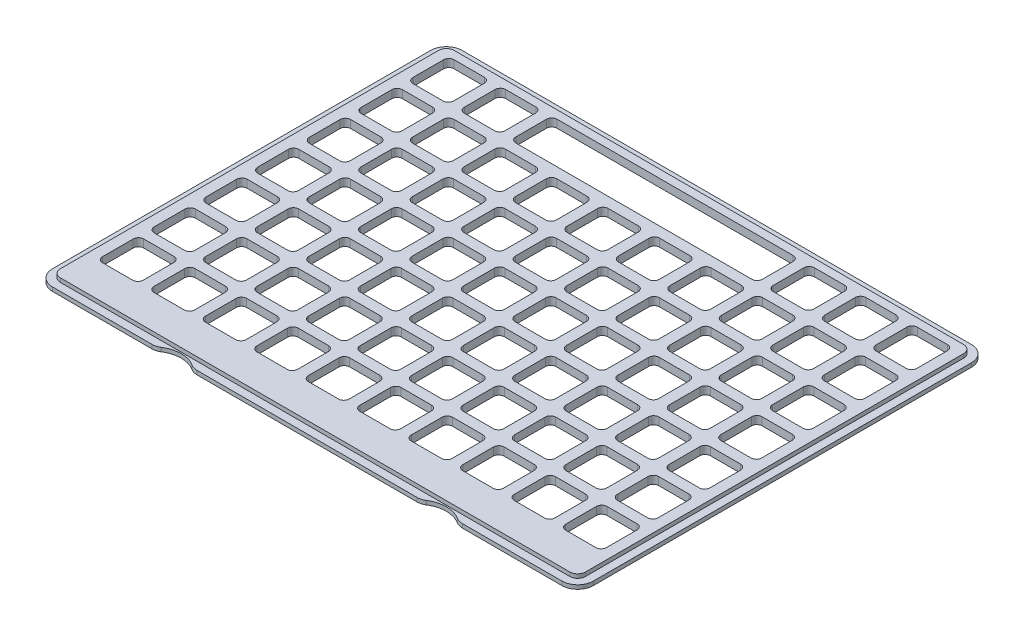
from build123d import *

# Parameters (mm, degrees)
SKETCH1_W               = 206
SKETCH1_H               = 156
OUTER_PROFILE_DEPTH     = 1.5
SKETCH2_W               = 200
SKETCH2_H               = 150
INNER_PROFILE_DEPTH     = 1.5
FILLET1_R               = 3
FILLET2_R               = 6
SKETCH5_W               = 15.5
SKETCH5_H               = 15.7
CUTOUT_DEPTH            = 130.236217834
CORNER_RAD_R            = 2
LPATTERN1_DEPTH         = 3
SKETCH6_W               = 89.9
SKETCH6_H               = 15.7
CUT_EXTRUDE1_DEPTH      = 130.236217834
BASE_RIDGE_DEPTH        = 130.236217834
CORNER_R                = 5
CORNER_OF_BASE_RIDGES_R = 5


# Read off the part's stored shape, not the designer's step: LPattern1
with BuildPart() as part:
    # Sketch1 → Outer Profile (new body)
    with BuildSketch(Plane(origin=(0, 0, 0), x_dir=(1, 0, 0), z_dir=(0, 1, 0))):
        Rectangle(SKETCH1_W, SKETCH1_H)
    extrude(amount=OUTER_PROFILE_DEPTH)

    # Sketch2 → Inner Profile (add)
    with BuildSketch(Plane(origin=(0, 1.5, 0), x_dir=(1, 0, 0), z_dir=(0, 1, 0))):
        Rectangle(SKETCH2_W, SKETCH2_H)
    extrude(amount=INNER_PROFILE_DEPTH)

    # Fillet1
    fillet1_edges = [part.edges().sort_by_distance(p)[0] for p in [
        (100, 2.25, 75),
        (100, 2.25, -75),
        (-100, 2.25, -75),
        (-100, 2.25, 75),
    ]]
    fillet(fillet1_edges, radius=FILLET1_R)

    # Fillet2
    fillet2_edges = [part.edges().sort_by_distance(p)[0] for p in [
        (103, 0.75, 78),
        (-103, 0.75, 78),
        (-103, 0.75, -78),
        (103, 0.75, -78),
    ]]
    fillet(fillet2_edges, radius=FILLET2_R)

    # Sketch5 → Cutout (cut, through all)
    with BuildSketch(Plane(origin=(0, 3, 0), x_dir=(1, 0, 0), z_dir=(0, 1, 0))):
        with Locations((-88.2, -54.15)):
            Rectangle(SKETCH5_W, SKETCH5_H)
    extrude(amount=-CUTOUT_DEPTH, mode=Mode.SUBTRACT)

    # Corner Rad
    corner_rad_edges = [part.edges().sort_by_distance(p)[0] for p in [
        (-95.95, 1.5, 62),
        (-95.95, 1.5, 46.3),
        (-80.45, 1.5, 46.3),
        (-80.45, 1.5, 62),
    ]]
    fillet(corner_rad_edges, radius=CORNER_RAD_R)

    # LPattern1 outline → LPattern1 (cut)
    with BuildSketch(Plane(origin=(0, 0, 0), x_dir=(1, 0, 0), z_dir=(0, 1, 0))):
        with BuildLine():
            ThreePointArc((-93.95, -26.6), (-95.364213562, -27.185786438), (-95.95, -28.6))
            Line((-95.95, -28.6), (-95.95, -40.3))
            ThreePointArc((-95.95, -40.3), (-95.364213562, -41.714213562), (-93.95, -42.3))
            Line((-93.95, -42.3), (-82.45, -42.3))
            ThreePointArc((-82.45, -42.3), (-81.035786438, -41.714213562), (-80.45, -40.3))
            Line((-80.45, -40.3), (-80.45, -28.6))
            ThreePointArc((-80.45, -28.6), (-81.035786438, -27.185786438), (-82.45, -26.6))
            Line((-82.45, -26.6), (-93.95, -26.6))
        make_face()
        with BuildLine():
            ThreePointArc((-93.95, -6.9), (-95.364213562, -7.485786438), (-95.95, -8.9))
            Line((-95.95, -8.9), (-95.95, -20.6))
            ThreePointArc((-95.95, -20.6), (-95.364213562, -22.014213562), (-93.95, -22.6))
            Line((-93.95, -22.6), (-82.45, -22.6))
            ThreePointArc((-82.45, -22.6), (-81.035786438, -22.014213562), (-80.45, -20.6))
            Line((-80.45, -20.6), (-80.45, -8.9))
            ThreePointArc((-80.45, -8.9), (-81.035786438, -7.485786438), (-82.45, -6.9))
            Line((-82.45, -6.9), (-93.95, -6.9))
        make_face()
        with BuildLine():
            ThreePointArc((-93.95, 12.8), (-95.364213562, 12.214213562), (-95.95, 10.8))
            Line((-95.95, 10.8), (-95.95, -0.9))
            ThreePointArc((-95.95, -0.9), (-95.364213562, -2.314213562), (-93.95, -2.9))
            Line((-93.95, -2.9), (-82.45, -2.9))
            ThreePointArc((-82.45, -2.9), (-81.035786438, -2.314213562), (-80.45, -0.9))
            Line((-80.45, -0.9), (-80.45, 10.8))
            ThreePointArc((-80.45, 10.8), (-81.035786438, 12.214213562), (-82.45, 12.8))
            Line((-82.45, 12.8), (-93.95, 12.8))
        make_face()
        with BuildLine():
            ThreePointArc((-93.95, 32.5), (-95.364213562, 31.914213562), (-95.95, 30.5))
            Line((-95.95, 30.5), (-95.95, 18.8))
            ThreePointArc((-95.95, 18.8), (-95.364213562, 17.385786438), (-93.95, 16.8))
            Line((-93.95, 16.8), (-82.45, 16.8))
            ThreePointArc((-82.45, 16.8), (-81.035786438, 17.385786438), (-80.45, 18.8))
            Line((-80.45, 18.8), (-80.45, 30.5))
            ThreePointArc((-80.45, 30.5), (-81.035786438, 31.914213562), (-82.45, 32.5))
            Line((-82.45, 32.5), (-93.95, 32.5))
        make_face()
        with BuildLine():
            ThreePointArc((-93.95, 52.2), (-95.364213562, 51.614213562), (-95.95, 50.2))
            Line((-95.95, 50.2), (-95.95, 38.5))
            ThreePointArc((-95.95, 38.5), (-95.364213562, 37.085786438), (-93.95, 36.5))
            Line((-93.95, 36.5), (-82.45, 36.5))
            ThreePointArc((-82.45, 36.5), (-81.035786438, 37.085786438), (-80.45, 38.5))
            Line((-80.45, 38.5), (-80.45, 50.2))
            ThreePointArc((-80.45, 50.2), (-81.035786438, 51.614213562), (-82.45, 52.2))
            Line((-82.45, 52.2), (-93.95, 52.2))
        make_face()
        with BuildLine():
            ThreePointArc((-93.95, 71.9), (-95.364213562, 71.314213562), (-95.95, 69.9))
            Line((-95.95, 69.9), (-95.95, 58.2))
            ThreePointArc((-95.95, 58.2), (-95.364213562, 56.785786438), (-93.95, 56.2))
            Line((-93.95, 56.2), (-82.45, 56.2))
            ThreePointArc((-82.45, 56.2), (-81.035786438, 56.785786438), (-80.45, 58.2))
            Line((-80.45, 58.2), (-80.45, 69.9))
            ThreePointArc((-80.45, 69.9), (-81.035786438, 71.314213562), (-82.45, 71.9))
            Line((-82.45, 71.9), (-93.95, 71.9))
        make_face()
        with BuildLine():
            ThreePointArc((-60.85, -48.3), (-61.435786438, -46.885786438), (-62.85, -46.3))
            Line((-62.85, -46.3), (-74.35, -46.3))
            ThreePointArc((-74.35, -46.3), (-75.764213562, -46.885786438), (-76.35, -48.3))
            Line((-76.35, -48.3), (-76.35, -60))
            ThreePointArc((-76.35, -60), (-75.764213562, -61.414213562), (-74.35, -62))
            Line((-74.35, -62), (-62.85, -62))
            ThreePointArc((-62.85, -62), (-61.435786438, -61.414213562), (-60.85, -60))
            Line((-60.85, -60), (-60.85, -48.3))
        make_face()
        with BuildLine():
            ThreePointArc((-41.25, -48.3), (-41.835786438, -46.885786438), (-43.25, -46.3))
            Line((-43.25, -46.3), (-54.75, -46.3))
            ThreePointArc((-54.75, -46.3), (-56.164213562, -46.885786438), (-56.75, -48.3))
            Line((-56.75, -48.3), (-56.75, -60))
            ThreePointArc((-56.75, -60), (-56.164213562, -61.414213562), (-54.75, -62))
            Line((-54.75, -62), (-43.25, -62))
            ThreePointArc((-43.25, -62), (-41.835786438, -61.414213562), (-41.25, -60))
            Line((-41.25, -60), (-41.25, -48.3))
        make_face()
        with BuildLine():
            ThreePointArc((-21.65, -48.3), (-22.235786438, -46.885786438), (-23.65, -46.3))
            Line((-23.65, -46.3), (-35.15, -46.3))
            ThreePointArc((-35.15, -46.3), (-36.564213562, -46.885786438), (-37.15, -48.3))
            Line((-37.15, -48.3), (-37.15, -60))
            ThreePointArc((-37.15, -60), (-36.564213562, -61.414213562), (-35.15, -62))
            Line((-35.15, -62), (-23.65, -62))
            ThreePointArc((-23.65, -62), (-22.235786438, -61.414213562), (-21.65, -60))
            Line((-21.65, -60), (-21.65, -48.3))
        make_face()
        with BuildLine():
            ThreePointArc((-2.05, -48.3), (-2.635786438, -46.885786438), (-4.05, -46.3))
            Line((-4.05, -46.3), (-15.55, -46.3))
            ThreePointArc((-15.55, -46.3), (-16.964213562, -46.885786438), (-17.55, -48.3))
            Line((-17.55, -48.3), (-17.55, -60))
            ThreePointArc((-17.55, -60), (-16.964213562, -61.414213562), (-15.55, -62))
            Line((-15.55, -62), (-4.05, -62))
            ThreePointArc((-4.05, -62), (-2.635786438, -61.414213562), (-2.05, -60))
            Line((-2.05, -60), (-2.05, -48.3))
        make_face()
        with BuildLine():
            ThreePointArc((17.55, -48.3), (16.964213562, -46.885786438), (15.55, -46.3))
            Line((15.55, -46.3), (4.05, -46.3))
            ThreePointArc((4.05, -46.3), (2.635786438, -46.885786438), (2.05, -48.3))
            Line((2.05, -48.3), (2.05, -60))
            ThreePointArc((2.05, -60), (2.635786438, -61.414213562), (4.05, -62))
            Line((4.05, -62), (15.55, -62))
            ThreePointArc((15.55, -62), (16.964213562, -61.414213562), (17.55, -60))
            Line((17.55, -60), (17.55, -48.3))
        make_face()
        with BuildLine():
            ThreePointArc((37.15, -48.3), (36.564213562, -46.885786438), (35.15, -46.3))
            Line((35.15, -46.3), (23.65, -46.3))
            ThreePointArc((23.65, -46.3), (22.235786438, -46.885786438), (21.65, -48.3))
            Line((21.65, -48.3), (21.65, -60))
            ThreePointArc((21.65, -60), (22.235786438, -61.414213562), (23.65, -62))
            Line((23.65, -62), (35.15, -62))
            ThreePointArc((35.15, -62), (36.564213562, -61.414213562), (37.15, -60))
            Line((37.15, -60), (37.15, -48.3))
        make_face()
        with BuildLine():
            ThreePointArc((56.75, -48.3), (56.164213562, -46.885786438), (54.75, -46.3))
            Line((54.75, -46.3), (43.25, -46.3))
            ThreePointArc((43.25, -46.3), (41.835786438, -46.885786438), (41.25, -48.3))
            Line((41.25, -48.3), (41.25, -60))
            ThreePointArc((41.25, -60), (41.835786438, -61.414213562), (43.25, -62))
            Line((43.25, -62), (54.75, -62))
            ThreePointArc((54.75, -62), (56.164213562, -61.414213562), (56.75, -60))
            Line((56.75, -60), (56.75, -48.3))
        make_face()
        with BuildLine():
            ThreePointArc((76.35, -48.3), (75.764213562, -46.885786438), (74.35, -46.3))
            Line((74.35, -46.3), (62.85, -46.3))
            ThreePointArc((62.85, -46.3), (61.435786438, -46.885786438), (60.85, -48.3))
            Line((60.85, -48.3), (60.85, -60))
            ThreePointArc((60.85, -60), (61.435786438, -61.414213562), (62.85, -62))
            Line((62.85, -62), (74.35, -62))
            ThreePointArc((74.35, -62), (75.764213562, -61.414213562), (76.35, -60))
            Line((76.35, -60), (76.35, -48.3))
        make_face()
        with BuildLine():
            ThreePointArc((95.95, -48.3), (95.364213562, -46.885786438), (93.95, -46.3))
            Line((93.95, -46.3), (82.45, -46.3))
            ThreePointArc((82.45, -46.3), (81.035786438, -46.885786438), (80.45, -48.3))
            Line((80.45, -48.3), (80.45, -60))
            ThreePointArc((80.45, -60), (81.035786438, -61.414213562), (82.45, -62))
            Line((82.45, -62), (93.95, -62))
            ThreePointArc((93.95, -62), (95.364213562, -61.414213562), (95.95, -60))
            Line((95.95, -60), (95.95, -48.3))
        make_face()
        with BuildLine():
            ThreePointArc((-60.85, -28.6), (-61.435786438, -27.185786438), (-62.85, -26.6))
            Line((-62.85, -26.6), (-74.35, -26.6))
            ThreePointArc((-74.35, -26.6), (-75.764213562, -27.185786438), (-76.35, -28.6))
            Line((-76.35, -28.6), (-76.35, -40.3))
            ThreePointArc((-76.35, -40.3), (-75.764213562, -41.714213562), (-74.35, -42.3))
            Line((-74.35, -42.3), (-62.85, -42.3))
            ThreePointArc((-62.85, -42.3), (-61.435786438, -41.714213562), (-60.85, -40.3))
            Line((-60.85, -40.3), (-60.85, -28.6))
        make_face()
        with BuildLine():
            ThreePointArc((-41.25, -28.6), (-41.835786438, -27.185786438), (-43.25, -26.6))
            Line((-43.25, -26.6), (-54.75, -26.6))
            ThreePointArc((-54.75, -26.6), (-56.164213562, -27.185786438), (-56.75, -28.6))
            Line((-56.75, -28.6), (-56.75, -40.3))
            ThreePointArc((-56.75, -40.3), (-56.164213562, -41.714213562), (-54.75, -42.3))
            Line((-54.75, -42.3), (-43.25, -42.3))
            ThreePointArc((-43.25, -42.3), (-41.835786438, -41.714213562), (-41.25, -40.3))
            Line((-41.25, -40.3), (-41.25, -28.6))
        make_face()
        with BuildLine():
            ThreePointArc((-21.65, -28.6), (-22.235786438, -27.185786438), (-23.65, -26.6))
            Line((-23.65, -26.6), (-35.15, -26.6))
            ThreePointArc((-35.15, -26.6), (-36.564213562, -27.185786438), (-37.15, -28.6))
            Line((-37.15, -28.6), (-37.15, -40.3))
            ThreePointArc((-37.15, -40.3), (-36.564213562, -41.714213562), (-35.15, -42.3))
            Line((-35.15, -42.3), (-23.65, -42.3))
            ThreePointArc((-23.65, -42.3), (-22.235786438, -41.714213562), (-21.65, -40.3))
            Line((-21.65, -40.3), (-21.65, -28.6))
        make_face()
        with BuildLine():
            ThreePointArc((-2.05, -28.6), (-2.635786438, -27.185786438), (-4.05, -26.6))
            Line((-4.05, -26.6), (-15.55, -26.6))
            ThreePointArc((-15.55, -26.6), (-16.964213562, -27.185786438), (-17.55, -28.6))
            Line((-17.55, -28.6), (-17.55, -40.3))
            ThreePointArc((-17.55, -40.3), (-16.964213562, -41.714213562), (-15.55, -42.3))
            Line((-15.55, -42.3), (-4.05, -42.3))
            ThreePointArc((-4.05, -42.3), (-2.635786438, -41.714213562), (-2.05, -40.3))
            Line((-2.05, -40.3), (-2.05, -28.6))
        make_face()
        with BuildLine():
            ThreePointArc((17.55, -28.6), (16.964213562, -27.185786438), (15.55, -26.6))
            Line((15.55, -26.6), (4.05, -26.6))
            ThreePointArc((4.05, -26.6), (2.635786438, -27.185786438), (2.05, -28.6))
            Line((2.05, -28.6), (2.05, -40.3))
            ThreePointArc((2.05, -40.3), (2.635786438, -41.714213562), (4.05, -42.3))
            Line((4.05, -42.3), (15.55, -42.3))
            ThreePointArc((15.55, -42.3), (16.964213562, -41.714213562), (17.55, -40.3))
            Line((17.55, -40.3), (17.55, -28.6))
        make_face()
        with BuildLine():
            ThreePointArc((37.15, -28.6), (36.564213562, -27.185786438), (35.15, -26.6))
            Line((35.15, -26.6), (23.65, -26.6))
            ThreePointArc((23.65, -26.6), (22.235786438, -27.185786438), (21.65, -28.6))
            Line((21.65, -28.6), (21.65, -40.3))
            ThreePointArc((21.65, -40.3), (22.235786438, -41.714213562), (23.65, -42.3))
            Line((23.65, -42.3), (35.15, -42.3))
            ThreePointArc((35.15, -42.3), (36.564213562, -41.714213562), (37.15, -40.3))
            Line((37.15, -40.3), (37.15, -28.6))
        make_face()
        with BuildLine():
            ThreePointArc((56.75, -28.6), (56.164213562, -27.185786438), (54.75, -26.6))
            Line((54.75, -26.6), (43.25, -26.6))
            ThreePointArc((43.25, -26.6), (41.835786438, -27.185786438), (41.25, -28.6))
            Line((41.25, -28.6), (41.25, -40.3))
            ThreePointArc((41.25, -40.3), (41.835786438, -41.714213562), (43.25, -42.3))
            Line((43.25, -42.3), (54.75, -42.3))
            ThreePointArc((54.75, -42.3), (56.164213562, -41.714213562), (56.75, -40.3))
            Line((56.75, -40.3), (56.75, -28.6))
        make_face()
        with BuildLine():
            ThreePointArc((76.35, -28.6), (75.764213562, -27.185786438), (74.35, -26.6))
            Line((74.35, -26.6), (62.85, -26.6))
            ThreePointArc((62.85, -26.6), (61.435786438, -27.185786438), (60.85, -28.6))
            Line((60.85, -28.6), (60.85, -40.3))
            ThreePointArc((60.85, -40.3), (61.435786438, -41.714213562), (62.85, -42.3))
            Line((62.85, -42.3), (74.35, -42.3))
            ThreePointArc((74.35, -42.3), (75.764213562, -41.714213562), (76.35, -40.3))
            Line((76.35, -40.3), (76.35, -28.6))
        make_face()
        with BuildLine():
            ThreePointArc((95.95, -28.6), (95.364213562, -27.185786438), (93.95, -26.6))
            Line((93.95, -26.6), (82.45, -26.6))
            ThreePointArc((82.45, -26.6), (81.035786438, -27.185786438), (80.45, -28.6))
            Line((80.45, -28.6), (80.45, -40.3))
            ThreePointArc((80.45, -40.3), (81.035786438, -41.714213562), (82.45, -42.3))
            Line((82.45, -42.3), (93.95, -42.3))
            ThreePointArc((93.95, -42.3), (95.364213562, -41.714213562), (95.95, -40.3))
            Line((95.95, -40.3), (95.95, -28.6))
        make_face()
        with BuildLine():
            ThreePointArc((-60.85, -8.9), (-61.435786438, -7.485786438), (-62.85, -6.9))
            Line((-62.85, -6.9), (-74.35, -6.9))
            ThreePointArc((-74.35, -6.9), (-75.764213562, -7.485786438), (-76.35, -8.9))
            Line((-76.35, -8.9), (-76.35, -20.6))
            ThreePointArc((-76.35, -20.6), (-75.764213562, -22.014213562), (-74.35, -22.6))
            Line((-74.35, -22.6), (-62.85, -22.6))
            ThreePointArc((-62.85, -22.6), (-61.435786438, -22.014213562), (-60.85, -20.6))
            Line((-60.85, -20.6), (-60.85, -8.9))
        make_face()
        with BuildLine():
            ThreePointArc((-41.25, -8.9), (-41.835786438, -7.485786438), (-43.25, -6.9))
            Line((-43.25, -6.9), (-54.75, -6.9))
            ThreePointArc((-54.75, -6.9), (-56.164213562, -7.485786438), (-56.75, -8.9))
            Line((-56.75, -8.9), (-56.75, -20.6))
            ThreePointArc((-56.75, -20.6), (-56.164213562, -22.014213562), (-54.75, -22.6))
            Line((-54.75, -22.6), (-43.25, -22.6))
            ThreePointArc((-43.25, -22.6), (-41.835786438, -22.014213562), (-41.25, -20.6))
            Line((-41.25, -20.6), (-41.25, -8.9))
        make_face()
        with BuildLine():
            ThreePointArc((-21.65, -8.9), (-22.235786438, -7.485786438), (-23.65, -6.9))
            Line((-23.65, -6.9), (-35.15, -6.9))
            ThreePointArc((-35.15, -6.9), (-36.564213562, -7.485786438), (-37.15, -8.9))
            Line((-37.15, -8.9), (-37.15, -20.6))
            ThreePointArc((-37.15, -20.6), (-36.564213562, -22.014213562), (-35.15, -22.6))
            Line((-35.15, -22.6), (-23.65, -22.6))
            ThreePointArc((-23.65, -22.6), (-22.235786438, -22.014213562), (-21.65, -20.6))
            Line((-21.65, -20.6), (-21.65, -8.9))
        make_face()
        with BuildLine():
            ThreePointArc((-2.05, -8.9), (-2.635786438, -7.485786438), (-4.05, -6.9))
            Line((-4.05, -6.9), (-15.55, -6.9))
            ThreePointArc((-15.55, -6.9), (-16.964213562, -7.485786438), (-17.55, -8.9))
            Line((-17.55, -8.9), (-17.55, -20.6))
            ThreePointArc((-17.55, -20.6), (-16.964213562, -22.014213562), (-15.55, -22.6))
            Line((-15.55, -22.6), (-4.05, -22.6))
            ThreePointArc((-4.05, -22.6), (-2.635786438, -22.014213562), (-2.05, -20.6))
            Line((-2.05, -20.6), (-2.05, -8.9))
        make_face()
        with BuildLine():
            ThreePointArc((17.55, -8.9), (16.964213562, -7.485786438), (15.55, -6.9))
            Line((15.55, -6.9), (4.05, -6.9))
            ThreePointArc((4.05, -6.9), (2.635786438, -7.485786438), (2.05, -8.9))
            Line((2.05, -8.9), (2.05, -20.6))
            ThreePointArc((2.05, -20.6), (2.635786438, -22.014213562), (4.05, -22.6))
            Line((4.05, -22.6), (15.55, -22.6))
            ThreePointArc((15.55, -22.6), (16.964213562, -22.014213562), (17.55, -20.6))
            Line((17.55, -20.6), (17.55, -8.9))
        make_face()
        with BuildLine():
            ThreePointArc((37.15, -8.9), (36.564213562, -7.485786438), (35.15, -6.9))
            Line((35.15, -6.9), (23.65, -6.9))
            ThreePointArc((23.65, -6.9), (22.235786438, -7.485786438), (21.65, -8.9))
            Line((21.65, -8.9), (21.65, -20.6))
            ThreePointArc((21.65, -20.6), (22.235786438, -22.014213562), (23.65, -22.6))
            Line((23.65, -22.6), (35.15, -22.6))
            ThreePointArc((35.15, -22.6), (36.564213562, -22.014213562), (37.15, -20.6))
            Line((37.15, -20.6), (37.15, -8.9))
        make_face()
        with BuildLine():
            ThreePointArc((56.75, -8.9), (56.164213562, -7.485786438), (54.75, -6.9))
            Line((54.75, -6.9), (43.25, -6.9))
            ThreePointArc((43.25, -6.9), (41.835786438, -7.485786438), (41.25, -8.9))
            Line((41.25, -8.9), (41.25, -20.6))
            ThreePointArc((41.25, -20.6), (41.835786438, -22.014213562), (43.25, -22.6))
            Line((43.25, -22.6), (54.75, -22.6))
            ThreePointArc((54.75, -22.6), (56.164213562, -22.014213562), (56.75, -20.6))
            Line((56.75, -20.6), (56.75, -8.9))
        make_face()
        with BuildLine():
            ThreePointArc((76.35, -8.9), (75.764213562, -7.485786438), (74.35, -6.9))
            Line((74.35, -6.9), (62.85, -6.9))
            ThreePointArc((62.85, -6.9), (61.435786438, -7.485786438), (60.85, -8.9))
            Line((60.85, -8.9), (60.85, -20.6))
            ThreePointArc((60.85, -20.6), (61.435786438, -22.014213562), (62.85, -22.6))
            Line((62.85, -22.6), (74.35, -22.6))
            ThreePointArc((74.35, -22.6), (75.764213562, -22.014213562), (76.35, -20.6))
            Line((76.35, -20.6), (76.35, -8.9))
        make_face()
        with BuildLine():
            ThreePointArc((95.95, -8.9), (95.364213562, -7.485786438), (93.95, -6.9))
            Line((93.95, -6.9), (82.45, -6.9))
            ThreePointArc((82.45, -6.9), (81.035786438, -7.485786438), (80.45, -8.9))
            Line((80.45, -8.9), (80.45, -20.6))
            ThreePointArc((80.45, -20.6), (81.035786438, -22.014213562), (82.45, -22.6))
            Line((82.45, -22.6), (93.95, -22.6))
            ThreePointArc((93.95, -22.6), (95.364213562, -22.014213562), (95.95, -20.6))
            Line((95.95, -20.6), (95.95, -8.9))
        make_face()
        with BuildLine():
            ThreePointArc((-60.85, 10.8), (-61.435786438, 12.214213562), (-62.85, 12.8))
            Line((-62.85, 12.8), (-74.35, 12.8))
            ThreePointArc((-74.35, 12.8), (-75.764213562, 12.214213562), (-76.35, 10.8))
            Line((-76.35, 10.8), (-76.35, -0.9))
            ThreePointArc((-76.35, -0.9), (-75.764213562, -2.314213562), (-74.35, -2.9))
            Line((-74.35, -2.9), (-62.85, -2.9))
            ThreePointArc((-62.85, -2.9), (-61.435786438, -2.314213562), (-60.85, -0.9))
            Line((-60.85, -0.9), (-60.85, 10.8))
        make_face()
        with BuildLine():
            ThreePointArc((-41.25, 10.8), (-41.835786438, 12.214213562), (-43.25, 12.8))
            Line((-43.25, 12.8), (-54.75, 12.8))
            ThreePointArc((-54.75, 12.8), (-56.164213562, 12.214213562), (-56.75, 10.8))
            Line((-56.75, 10.8), (-56.75, -0.9))
            ThreePointArc((-56.75, -0.9), (-56.164213562, -2.314213562), (-54.75, -2.9))
            Line((-54.75, -2.9), (-43.25, -2.9))
            ThreePointArc((-43.25, -2.9), (-41.835786438, -2.314213562), (-41.25, -0.9))
            Line((-41.25, -0.9), (-41.25, 10.8))
        make_face()
        with BuildLine():
            ThreePointArc((-21.65, 10.8), (-22.235786438, 12.214213562), (-23.65, 12.8))
            Line((-23.65, 12.8), (-35.15, 12.8))
            ThreePointArc((-35.15, 12.8), (-36.564213562, 12.214213562), (-37.15, 10.8))
            Line((-37.15, 10.8), (-37.15, -0.9))
            ThreePointArc((-37.15, -0.9), (-36.564213562, -2.314213562), (-35.15, -2.9))
            Line((-35.15, -2.9), (-23.65, -2.9))
            ThreePointArc((-23.65, -2.9), (-22.235786438, -2.314213562), (-21.65, -0.9))
            Line((-21.65, -0.9), (-21.65, 10.8))
        make_face()
        with BuildLine():
            ThreePointArc((-2.05, 10.8), (-2.635786438, 12.214213562), (-4.05, 12.8))
            Line((-4.05, 12.8), (-15.55, 12.8))
            ThreePointArc((-15.55, 12.8), (-16.964213562, 12.214213562), (-17.55, 10.8))
            Line((-17.55, 10.8), (-17.55, -0.9))
            ThreePointArc((-17.55, -0.9), (-16.964213562, -2.314213562), (-15.55, -2.9))
            Line((-15.55, -2.9), (-4.05, -2.9))
            ThreePointArc((-4.05, -2.9), (-2.635786438, -2.314213562), (-2.05, -0.9))
            Line((-2.05, -0.9), (-2.05, 10.8))
        make_face()
        with BuildLine():
            ThreePointArc((17.55, 10.8), (16.964213562, 12.214213562), (15.55, 12.8))
            Line((15.55, 12.8), (4.05, 12.8))
            ThreePointArc((4.05, 12.8), (2.635786438, 12.214213562), (2.05, 10.8))
            Line((2.05, 10.8), (2.05, -0.9))
            ThreePointArc((2.05, -0.9), (2.635786438, -2.314213562), (4.05, -2.9))
            Line((4.05, -2.9), (15.55, -2.9))
            ThreePointArc((15.55, -2.9), (16.964213562, -2.314213562), (17.55, -0.9))
            Line((17.55, -0.9), (17.55, 10.8))
        make_face()
        with BuildLine():
            ThreePointArc((37.15, 10.8), (36.564213562, 12.214213562), (35.15, 12.8))
            Line((35.15, 12.8), (23.65, 12.8))
            ThreePointArc((23.65, 12.8), (22.235786438, 12.214213562), (21.65, 10.8))
            Line((21.65, 10.8), (21.65, -0.9))
            ThreePointArc((21.65, -0.9), (22.235786438, -2.314213562), (23.65, -2.9))
            Line((23.65, -2.9), (35.15, -2.9))
            ThreePointArc((35.15, -2.9), (36.564213562, -2.314213562), (37.15, -0.9))
            Line((37.15, -0.9), (37.15, 10.8))
        make_face()
        with BuildLine():
            ThreePointArc((56.75, 10.8), (56.164213562, 12.214213562), (54.75, 12.8))
            Line((54.75, 12.8), (43.25, 12.8))
            ThreePointArc((43.25, 12.8), (41.835786438, 12.214213562), (41.25, 10.8))
            Line((41.25, 10.8), (41.25, -0.9))
            ThreePointArc((41.25, -0.9), (41.835786438, -2.314213562), (43.25, -2.9))
            Line((43.25, -2.9), (54.75, -2.9))
            ThreePointArc((54.75, -2.9), (56.164213562, -2.314213562), (56.75, -0.9))
            Line((56.75, -0.9), (56.75, 10.8))
        make_face()
        with BuildLine():
            ThreePointArc((76.35, 10.8), (75.764213562, 12.214213562), (74.35, 12.8))
            Line((74.35, 12.8), (62.85, 12.8))
            ThreePointArc((62.85, 12.8), (61.435786438, 12.214213562), (60.85, 10.8))
            Line((60.85, 10.8), (60.85, -0.9))
            ThreePointArc((60.85, -0.9), (61.435786438, -2.314213562), (62.85, -2.9))
            Line((62.85, -2.9), (74.35, -2.9))
            ThreePointArc((74.35, -2.9), (75.764213562, -2.314213562), (76.35, -0.9))
            Line((76.35, -0.9), (76.35, 10.8))
        make_face()
        with BuildLine():
            ThreePointArc((95.95, 10.8), (95.364213562, 12.214213562), (93.95, 12.8))
            Line((93.95, 12.8), (82.45, 12.8))
            ThreePointArc((82.45, 12.8), (81.035786438, 12.214213562), (80.45, 10.8))
            Line((80.45, 10.8), (80.45, -0.9))
            ThreePointArc((80.45, -0.9), (81.035786438, -2.314213562), (82.45, -2.9))
            Line((82.45, -2.9), (93.95, -2.9))
            ThreePointArc((93.95, -2.9), (95.364213562, -2.314213562), (95.95, -0.9))
            Line((95.95, -0.9), (95.95, 10.8))
        make_face()
        with BuildLine():
            ThreePointArc((-60.85, 30.5), (-61.435786438, 31.914213562), (-62.85, 32.5))
            Line((-62.85, 32.5), (-74.35, 32.5))
            ThreePointArc((-74.35, 32.5), (-75.764213562, 31.914213562), (-76.35, 30.5))
            Line((-76.35, 30.5), (-76.35, 18.8))
            ThreePointArc((-76.35, 18.8), (-75.764213562, 17.385786438), (-74.35, 16.8))
            Line((-74.35, 16.8), (-62.85, 16.8))
            ThreePointArc((-62.85, 16.8), (-61.435786438, 17.385786438), (-60.85, 18.8))
            Line((-60.85, 18.8), (-60.85, 30.5))
        make_face()
        with BuildLine():
            ThreePointArc((-41.25, 30.5), (-41.835786438, 31.914213562), (-43.25, 32.5))
            Line((-43.25, 32.5), (-54.75, 32.5))
            ThreePointArc((-54.75, 32.5), (-56.164213562, 31.914213562), (-56.75, 30.5))
            Line((-56.75, 30.5), (-56.75, 18.8))
            ThreePointArc((-56.75, 18.8), (-56.164213562, 17.385786438), (-54.75, 16.8))
            Line((-54.75, 16.8), (-43.25, 16.8))
            ThreePointArc((-43.25, 16.8), (-41.835786438, 17.385786438), (-41.25, 18.8))
            Line((-41.25, 18.8), (-41.25, 30.5))
        make_face()
        with BuildLine():
            ThreePointArc((-21.65, 30.5), (-22.235786438, 31.914213562), (-23.65, 32.5))
            Line((-23.65, 32.5), (-35.15, 32.5))
            ThreePointArc((-35.15, 32.5), (-36.564213562, 31.914213562), (-37.15, 30.5))
            Line((-37.15, 30.5), (-37.15, 18.8))
            ThreePointArc((-37.15, 18.8), (-36.564213562, 17.385786438), (-35.15, 16.8))
            Line((-35.15, 16.8), (-23.65, 16.8))
            ThreePointArc((-23.65, 16.8), (-22.235786438, 17.385786438), (-21.65, 18.8))
            Line((-21.65, 18.8), (-21.65, 30.5))
        make_face()
        with BuildLine():
            ThreePointArc((-2.05, 30.5), (-2.635786438, 31.914213562), (-4.05, 32.5))
            Line((-4.05, 32.5), (-15.55, 32.5))
            ThreePointArc((-15.55, 32.5), (-16.964213562, 31.914213562), (-17.55, 30.5))
            Line((-17.55, 30.5), (-17.55, 18.8))
            ThreePointArc((-17.55, 18.8), (-16.964213562, 17.385786438), (-15.55, 16.8))
            Line((-15.55, 16.8), (-4.05, 16.8))
            ThreePointArc((-4.05, 16.8), (-2.635786438, 17.385786438), (-2.05, 18.8))
            Line((-2.05, 18.8), (-2.05, 30.5))
        make_face()
        with BuildLine():
            ThreePointArc((17.55, 30.5), (16.964213562, 31.914213562), (15.55, 32.5))
            Line((15.55, 32.5), (4.05, 32.5))
            ThreePointArc((4.05, 32.5), (2.635786438, 31.914213562), (2.05, 30.5))
            Line((2.05, 30.5), (2.05, 18.8))
            ThreePointArc((2.05, 18.8), (2.635786438, 17.385786438), (4.05, 16.8))
            Line((4.05, 16.8), (15.55, 16.8))
            ThreePointArc((15.55, 16.8), (16.964213562, 17.385786438), (17.55, 18.8))
            Line((17.55, 18.8), (17.55, 30.5))
        make_face()
        with BuildLine():
            ThreePointArc((37.15, 30.5), (36.564213562, 31.914213562), (35.15, 32.5))
            Line((35.15, 32.5), (23.65, 32.5))
            ThreePointArc((23.65, 32.5), (22.235786438, 31.914213562), (21.65, 30.5))
            Line((21.65, 30.5), (21.65, 18.8))
            ThreePointArc((21.65, 18.8), (22.235786438, 17.385786438), (23.65, 16.8))
            Line((23.65, 16.8), (35.15, 16.8))
            ThreePointArc((35.15, 16.8), (36.564213562, 17.385786438), (37.15, 18.8))
            Line((37.15, 18.8), (37.15, 30.5))
        make_face()
        with BuildLine():
            ThreePointArc((56.75, 30.5), (56.164213562, 31.914213562), (54.75, 32.5))
            Line((54.75, 32.5), (43.25, 32.5))
            ThreePointArc((43.25, 32.5), (41.835786438, 31.914213562), (41.25, 30.5))
            Line((41.25, 30.5), (41.25, 18.8))
            ThreePointArc((41.25, 18.8), (41.835786438, 17.385786438), (43.25, 16.8))
            Line((43.25, 16.8), (54.75, 16.8))
            ThreePointArc((54.75, 16.8), (56.164213562, 17.385786438), (56.75, 18.8))
            Line((56.75, 18.8), (56.75, 30.5))
        make_face()
        with BuildLine():
            ThreePointArc((76.35, 30.5), (75.764213562, 31.914213562), (74.35, 32.5))
            Line((74.35, 32.5), (62.85, 32.5))
            ThreePointArc((62.85, 32.5), (61.435786438, 31.914213562), (60.85, 30.5))
            Line((60.85, 30.5), (60.85, 18.8))
            ThreePointArc((60.85, 18.8), (61.435786438, 17.385786438), (62.85, 16.8))
            Line((62.85, 16.8), (74.35, 16.8))
            ThreePointArc((74.35, 16.8), (75.764213562, 17.385786438), (76.35, 18.8))
            Line((76.35, 18.8), (76.35, 30.5))
        make_face()
        with BuildLine():
            ThreePointArc((95.95, 30.5), (95.364213562, 31.914213562), (93.95, 32.5))
            Line((93.95, 32.5), (82.45, 32.5))
            ThreePointArc((82.45, 32.5), (81.035786438, 31.914213562), (80.45, 30.5))
            Line((80.45, 30.5), (80.45, 18.8))
            ThreePointArc((80.45, 18.8), (81.035786438, 17.385786438), (82.45, 16.8))
            Line((82.45, 16.8), (93.95, 16.8))
            ThreePointArc((93.95, 16.8), (95.364213562, 17.385786438), (95.95, 18.8))
            Line((95.95, 18.8), (95.95, 30.5))
        make_face()
        with BuildLine():
            ThreePointArc((-60.85, 50.2), (-61.435786438, 51.614213562), (-62.85, 52.2))
            Line((-62.85, 52.2), (-74.35, 52.2))
            ThreePointArc((-74.35, 52.2), (-75.764213562, 51.614213562), (-76.35, 50.2))
            Line((-76.35, 50.2), (-76.35, 38.5))
            ThreePointArc((-76.35, 38.5), (-75.764213562, 37.085786438), (-74.35, 36.5))
            Line((-74.35, 36.5), (-62.85, 36.5))
            ThreePointArc((-62.85, 36.5), (-61.435786438, 37.085786438), (-60.85, 38.5))
            Line((-60.85, 38.5), (-60.85, 50.2))
        make_face()
        with BuildLine():
            ThreePointArc((-41.25, 50.2), (-41.835786438, 51.614213562), (-43.25, 52.2))
            Line((-43.25, 52.2), (-54.75, 52.2))
            ThreePointArc((-54.75, 52.2), (-56.164213562, 51.614213562), (-56.75, 50.2))
            Line((-56.75, 50.2), (-56.75, 38.5))
            ThreePointArc((-56.75, 38.5), (-56.164213562, 37.085786438), (-54.75, 36.5))
            Line((-54.75, 36.5), (-43.25, 36.5))
            ThreePointArc((-43.25, 36.5), (-41.835786438, 37.085786438), (-41.25, 38.5))
            Line((-41.25, 38.5), (-41.25, 50.2))
        make_face()
        with BuildLine():
            ThreePointArc((-21.65, 50.2), (-22.235786438, 51.614213562), (-23.65, 52.2))
            Line((-23.65, 52.2), (-35.15, 52.2))
            ThreePointArc((-35.15, 52.2), (-36.564213562, 51.614213562), (-37.15, 50.2))
            Line((-37.15, 50.2), (-37.15, 38.5))
            ThreePointArc((-37.15, 38.5), (-36.564213562, 37.085786438), (-35.15, 36.5))
            Line((-35.15, 36.5), (-23.65, 36.5))
            ThreePointArc((-23.65, 36.5), (-22.235786438, 37.085786438), (-21.65, 38.5))
            Line((-21.65, 38.5), (-21.65, 50.2))
        make_face()
        with BuildLine():
            ThreePointArc((-2.05, 50.2), (-2.635786438, 51.614213562), (-4.05, 52.2))
            Line((-4.05, 52.2), (-15.55, 52.2))
            ThreePointArc((-15.55, 52.2), (-16.964213562, 51.614213562), (-17.55, 50.2))
            Line((-17.55, 50.2), (-17.55, 38.5))
            ThreePointArc((-17.55, 38.5), (-16.964213562, 37.085786438), (-15.55, 36.5))
            Line((-15.55, 36.5), (-4.05, 36.5))
            ThreePointArc((-4.05, 36.5), (-2.635786438, 37.085786438), (-2.05, 38.5))
            Line((-2.05, 38.5), (-2.05, 50.2))
        make_face()
        with BuildLine():
            ThreePointArc((17.55, 50.2), (16.964213562, 51.614213562), (15.55, 52.2))
            Line((15.55, 52.2), (4.05, 52.2))
            ThreePointArc((4.05, 52.2), (2.635786438, 51.614213562), (2.05, 50.2))
            Line((2.05, 50.2), (2.05, 38.5))
            ThreePointArc((2.05, 38.5), (2.635786438, 37.085786438), (4.05, 36.5))
            Line((4.05, 36.5), (15.55, 36.5))
            ThreePointArc((15.55, 36.5), (16.964213562, 37.085786438), (17.55, 38.5))
            Line((17.55, 38.5), (17.55, 50.2))
        make_face()
        with BuildLine():
            ThreePointArc((37.15, 50.2), (36.564213562, 51.614213562), (35.15, 52.2))
            Line((35.15, 52.2), (23.65, 52.2))
            ThreePointArc((23.65, 52.2), (22.235786438, 51.614213562), (21.65, 50.2))
            Line((21.65, 50.2), (21.65, 38.5))
            ThreePointArc((21.65, 38.5), (22.235786438, 37.085786438), (23.65, 36.5))
            Line((23.65, 36.5), (35.15, 36.5))
            ThreePointArc((35.15, 36.5), (36.564213562, 37.085786438), (37.15, 38.5))
            Line((37.15, 38.5), (37.15, 50.2))
        make_face()
        with BuildLine():
            ThreePointArc((56.75, 50.2), (56.164213562, 51.614213562), (54.75, 52.2))
            Line((54.75, 52.2), (43.25, 52.2))
            ThreePointArc((43.25, 52.2), (41.835786438, 51.614213562), (41.25, 50.2))
            Line((41.25, 50.2), (41.25, 38.5))
            ThreePointArc((41.25, 38.5), (41.835786438, 37.085786438), (43.25, 36.5))
            Line((43.25, 36.5), (54.75, 36.5))
            ThreePointArc((54.75, 36.5), (56.164213562, 37.085786438), (56.75, 38.5))
            Line((56.75, 38.5), (56.75, 50.2))
        make_face()
        with BuildLine():
            ThreePointArc((76.35, 50.2), (75.764213562, 51.614213562), (74.35, 52.2))
            Line((74.35, 52.2), (62.85, 52.2))
            ThreePointArc((62.85, 52.2), (61.435786438, 51.614213562), (60.85, 50.2))
            Line((60.85, 50.2), (60.85, 38.5))
            ThreePointArc((60.85, 38.5), (61.435786438, 37.085786438), (62.85, 36.5))
            Line((62.85, 36.5), (74.35, 36.5))
            ThreePointArc((74.35, 36.5), (75.764213562, 37.085786438), (76.35, 38.5))
            Line((76.35, 38.5), (76.35, 50.2))
        make_face()
        with BuildLine():
            ThreePointArc((95.95, 50.2), (95.364213562, 51.614213562), (93.95, 52.2))
            Line((93.95, 52.2), (82.45, 52.2))
            ThreePointArc((82.45, 52.2), (81.035786438, 51.614213562), (80.45, 50.2))
            Line((80.45, 50.2), (80.45, 38.5))
            ThreePointArc((80.45, 38.5), (81.035786438, 37.085786438), (82.45, 36.5))
            Line((82.45, 36.5), (93.95, 36.5))
            ThreePointArc((93.95, 36.5), (95.364213562, 37.085786438), (95.95, 38.5))
            Line((95.95, 38.5), (95.95, 50.2))
        make_face()
        with BuildLine():
            ThreePointArc((-60.85, 69.9), (-61.435786438, 71.314213562), (-62.85, 71.9))
            Line((-62.85, 71.9), (-74.35, 71.9))
            ThreePointArc((-74.35, 71.9), (-75.764213562, 71.314213562), (-76.35, 69.9))
            Line((-76.35, 69.9), (-76.35, 58.2))
            ThreePointArc((-76.35, 58.2), (-75.764213562, 56.785786438), (-74.35, 56.2))
            Line((-74.35, 56.2), (-62.85, 56.2))
            ThreePointArc((-62.85, 56.2), (-61.435786438, 56.785786438), (-60.85, 58.2))
            Line((-60.85, 58.2), (-60.85, 69.9))
        make_face()
        with BuildLine():
            ThreePointArc((-41.25, 69.9), (-41.835786438, 71.314213562), (-43.25, 71.9))
            Line((-43.25, 71.9), (-54.75, 71.9))
            ThreePointArc((-54.75, 71.9), (-56.164213562, 71.314213562), (-56.75, 69.9))
            Line((-56.75, 69.9), (-56.75, 58.2))
            ThreePointArc((-56.75, 58.2), (-56.164213562, 56.785786438), (-54.75, 56.2))
            Line((-54.75, 56.2), (-43.25, 56.2))
            ThreePointArc((-43.25, 56.2), (-41.835786438, 56.785786438), (-41.25, 58.2))
            Line((-41.25, 58.2), (-41.25, 69.9))
        make_face()
        with BuildLine():
            ThreePointArc((-21.65, 69.9), (-22.235786438, 71.314213562), (-23.65, 71.9))
            Line((-23.65, 71.9), (-35.15, 71.9))
            ThreePointArc((-35.15, 71.9), (-36.564213562, 71.314213562), (-37.15, 69.9))
            Line((-37.15, 69.9), (-37.15, 58.2))
            ThreePointArc((-37.15, 58.2), (-36.564213562, 56.785786438), (-35.15, 56.2))
            Line((-35.15, 56.2), (-23.65, 56.2))
            ThreePointArc((-23.65, 56.2), (-22.235786438, 56.785786438), (-21.65, 58.2))
            Line((-21.65, 58.2), (-21.65, 69.9))
        make_face()
        with BuildLine():
            ThreePointArc((-2.05, 69.9), (-2.635786438, 71.314213562), (-4.05, 71.9))
            Line((-4.05, 71.9), (-15.55, 71.9))
            ThreePointArc((-15.55, 71.9), (-16.964213562, 71.314213562), (-17.55, 69.9))
            Line((-17.55, 69.9), (-17.55, 58.2))
            ThreePointArc((-17.55, 58.2), (-16.964213562, 56.785786438), (-15.55, 56.2))
            Line((-15.55, 56.2), (-4.05, 56.2))
            ThreePointArc((-4.05, 56.2), (-2.635786438, 56.785786438), (-2.05, 58.2))
            Line((-2.05, 58.2), (-2.05, 69.9))
        make_face()
        with BuildLine():
            ThreePointArc((17.55, 69.9), (16.964213562, 71.314213562), (15.55, 71.9))
            Line((15.55, 71.9), (4.05, 71.9))
            ThreePointArc((4.05, 71.9), (2.635786438, 71.314213562), (2.05, 69.9))
            Line((2.05, 69.9), (2.05, 58.2))
            ThreePointArc((2.05, 58.2), (2.635786438, 56.785786438), (4.05, 56.2))
            Line((4.05, 56.2), (15.55, 56.2))
            ThreePointArc((15.55, 56.2), (16.964213562, 56.785786438), (17.55, 58.2))
            Line((17.55, 58.2), (17.55, 69.9))
        make_face()
        with BuildLine():
            ThreePointArc((37.15, 69.9), (36.564213562, 71.314213562), (35.15, 71.9))
            Line((35.15, 71.9), (23.65, 71.9))
            ThreePointArc((23.65, 71.9), (22.235786438, 71.314213562), (21.65, 69.9))
            Line((21.65, 69.9), (21.65, 58.2))
            ThreePointArc((21.65, 58.2), (22.235786438, 56.785786438), (23.65, 56.2))
            Line((23.65, 56.2), (35.15, 56.2))
            ThreePointArc((35.15, 56.2), (36.564213562, 56.785786438), (37.15, 58.2))
            Line((37.15, 58.2), (37.15, 69.9))
        make_face()
        with BuildLine():
            ThreePointArc((56.75, 69.9), (56.164213562, 71.314213562), (54.75, 71.9))
            Line((54.75, 71.9), (43.25, 71.9))
            ThreePointArc((43.25, 71.9), (41.835786438, 71.314213562), (41.25, 69.9))
            Line((41.25, 69.9), (41.25, 58.2))
            ThreePointArc((41.25, 58.2), (41.835786438, 56.785786438), (43.25, 56.2))
            Line((43.25, 56.2), (54.75, 56.2))
            ThreePointArc((54.75, 56.2), (56.164213562, 56.785786438), (56.75, 58.2))
            Line((56.75, 58.2), (56.75, 69.9))
        make_face()
        with BuildLine():
            ThreePointArc((76.35, 69.9), (75.764213562, 71.314213562), (74.35, 71.9))
            Line((74.35, 71.9), (62.85, 71.9))
            ThreePointArc((62.85, 71.9), (61.435786438, 71.314213562), (60.85, 69.9))
            Line((60.85, 69.9), (60.85, 58.2))
            ThreePointArc((60.85, 58.2), (61.435786438, 56.785786438), (62.85, 56.2))
            Line((62.85, 56.2), (74.35, 56.2))
            ThreePointArc((74.35, 56.2), (75.764213562, 56.785786438), (76.35, 58.2))
            Line((76.35, 58.2), (76.35, 69.9))
        make_face()
        with BuildLine():
            ThreePointArc((95.95, 69.9), (95.364213562, 71.314213562), (93.95, 71.9))
            Line((93.95, 71.9), (82.45, 71.9))
            ThreePointArc((82.45, 71.9), (81.035786438, 71.314213562), (80.45, 69.9))
            Line((80.45, 69.9), (80.45, 58.2))
            ThreePointArc((80.45, 58.2), (81.035786438, 56.785786438), (82.45, 56.2))
            Line((82.45, 56.2), (93.95, 56.2))
            ThreePointArc((93.95, 56.2), (95.364213562, 56.785786438), (95.95, 58.2))
            Line((95.95, 58.2), (95.95, 69.9))
        make_face()
    extrude(amount=LPATTERN1_DEPTH, mode=Mode.SUBTRACT)

    # Sketch6 → Cut-Extrude1 (cut, through all)
    with BuildSketch(Plane(origin=(0, 3, 0), x_dir=(1, 0, 0), z_dir=(0, 1, 0))):
        with Locations((-9.8, 64.05)):
            Rectangle(SKETCH6_W, SKETCH6_H)
    extrude(amount=-CUT_EXTRUDE1_DEPTH, mode=Mode.SUBTRACT)

    # Sketch7 → Base Ridge (cut, through all)
    with BuildSketch(Plane(origin=(0, 3, 0), x_dir=(1, 0, 0), z_dir=(0, 1, 0))):
        with BuildLine():
            Line((-57.5, -78), (-43.5, -78))
            ThreePointArc((-43.5, -78), (-50.5, -75.5), (-57.5, -78))
        make_face()
    base_ridge = extrude(amount=-BASE_RIDGE_DEPTH, mode=Mode.SUBTRACT)

    # Corner
    corner_edges = [part.edges().sort_by_distance(p)[0] for p in [
        (-57.5, 0.75, 78),
        (-43.5, 0.75, 78),
    ]]
    fillet(corner_edges, radius=CORNER_R)

    # Base Ridges: Base Ridge across plane
    add(base_ridge.mirror(Plane(origin=(0, 0, 0), x_dir=(0, 0, 1), z_dir=(1, 0, 0))), mode=Mode.SUBTRACT)

    # Corner of Base Ridges
    corner_of_base_ridges_edges = [part.edges().sort_by_distance(p)[0] for p in [
        (57.5, 0.75, 78),
        (43.5, 0.75, 78),
    ]]
    fillet(corner_of_base_ridges_edges, radius=CORNER_OF_BASE_RIDGES_R)


solid = part.part
